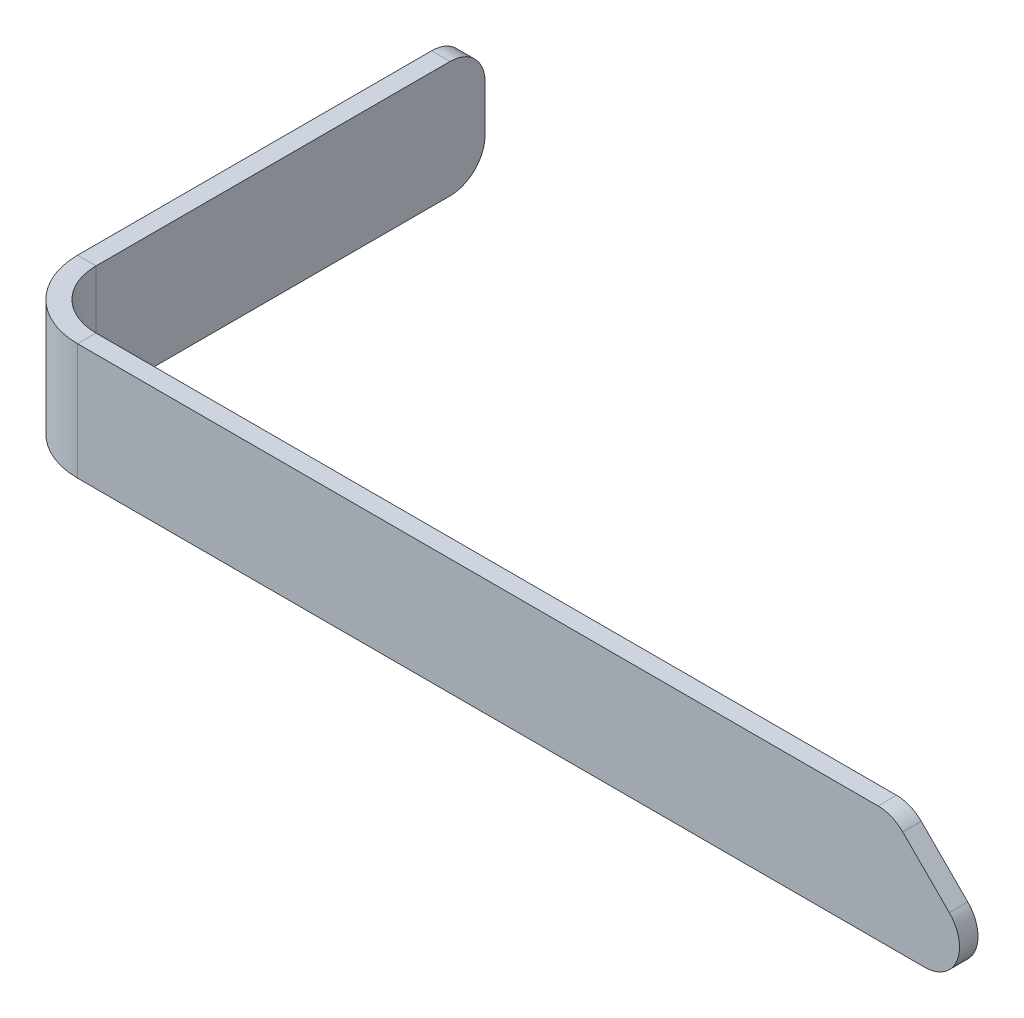
from build123d import *

# Parameters (mm, degrees)
SKETCH1_W                    = 85
SKETCH1_H                    = 10
BOSS_EXTRUDE1_DEPTH          = 1.6
CUT_EXTRUDE1_DEPTH           = 43.823007835
CUT_EXTRUDE1_DEPTH_BACK      = 10
CONVERT_SOLID1_DEPTH         = 0.0125
EDGE_FLANGE1_STRIP_W         = 16.35
EDGE_FLANGE1_STRIP_H         = 1.5875
EDGE_FLANGE1_STRIP_CUT_DEPTH = 10
EDGE_FLANGE1_DEPTH           = 10
FILLET2_R                    = 3


# Read off the part's stored shape, not the designer's step: Convert-Solid1
# Sheet-metal steps are written as plain solids
with BuildPart() as part:
    # Sketch1 → Boss-Extrude1 (new body)
    with BuildSketch(Plane.XY):
        Rectangle(SKETCH1_W, SKETCH1_H)
    extrude(amount=BOSS_EXTRUDE1_DEPTH)

    # Sketch2 → Cut-Extrude1 (cut, two sides: drawn at the far end of the back side and taken through both)
    with BuildSketch(Plane.XY.offset(1.6).offset(-CUT_EXTRUDE1_DEPTH_BACK)):
        Polygon((32.5, 5), (42.5, -5), (42.5, 5), align=None)
    extrude(amount=CUT_EXTRUDE1_DEPTH + CUT_EXTRUDE1_DEPTH_BACK, mode=Mode.SUBTRACT)

    # Convert-Solid1 outline → Convert-Solid1 (cut)
    with BuildSketch(Plane.XY):
        Polygon((32.5, 5), (-42.5, 5), (-42.5, -5), (42.5, -5), align=None)
    extrude(amount=CONVERT_SOLID1_DEPTH, mode=Mode.SUBTRACT)

    # Edge-Flange1 strip (across the edge) → Edge-Flange1 strip cut (cut)
    with BuildSketch(Plane(origin=(-42.5, -5, 0.0125), x_dir=(1, 0, 0), z_dir=(0, 1, 0))):
        with Locations((-3.175, -0.79375)):
            Rectangle(EDGE_FLANGE1_STRIP_W, EDGE_FLANGE1_STRIP_H)
    extrude(amount=EDGE_FLANGE1_STRIP_CUT_DEPTH, mode=Mode.SUBTRACT)

    # Edge-Flange1 section (across the edge) → Edge-Flange1 (add)
    with BuildSketch(Plane(origin=(-42.5, -5, 0.0125), x_dir=(1, 0, 0), z_dir=(0, 1, 0))):
        with BuildLine():
            Line((-1.5875, 5), (-1.5875, 38.4125))
            Line((-1.5875, 38.4125), (0, 38.4125))
            Line((0, 38.4125), (0, 5))
            ThreePointArc((0, 5), (1.464466094, 1.464466094), (5, 0))
            Line((5, 0), (5, -1.5875))
            ThreePointArc((5, -1.5875), (0.341934079, 0.341934079), (-1.5875, 5))
        make_face()
    extrude(amount=EDGE_FLANGE1_DEPTH)

    # Fillet2
    fillet2_edges = [part.edges().sort_by_distance(p)[0] for p in [
        (-43.29375, -5, -38.4),
        (-43.29375, 5, -38.4),
        (42.5, -5, 0.80625),
        (32.5, 5, 0.80625),
    ]]
    fillet(fillet2_edges, radius=FILLET2_R)


solid = part.part
